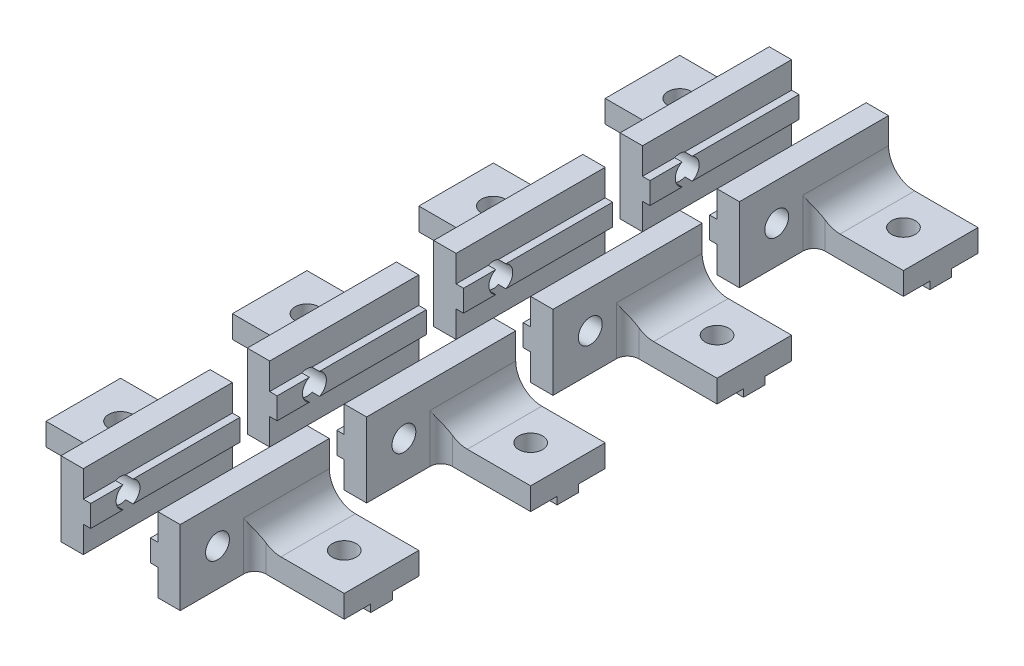
from build123d import *

# Parameters (mm, degrees)
MAIN_DEPTH                   = 20
ESQUISSE4_W                  = 20
ESQUISSE4_H                  = 2.9
VERTICALGUIDANCE_DEPTH       = 1
VERTICALHOLE_DEPTH           = 27.925824036
VERTICALHOLE_DEPTH_BACK      = 27.925824036
ESQUISSE2_R                  = 1.6
ESQUISSE5_W                  = 15
ESQUISSE5_H                  = 2.9
HORIZONTALGUIDANCE_DEPTH     = 1
HORIZONTALHOLE_DEPTH         = 26.961510049
HORIZONTALHOLE_DEPTH_BACK    = 26.961510049
ESQUISSE3_R                  = 1.6
ENL_V_MAT_EXTRU_4_DEPTH      = 26.961510049
ENL_V_MAT_EXTRU_4_DEPTH_BACK = 26.961510049
ESQUISSE9_W                  = 12
ESQUISSE9_H                  = 10
CONG_2_R                     = 1.5
R_P_TITION_LIN_AIRE1_COUNT   = 4
R_P_TITION_LIN_AIRE1_PITCH   = 25


with BuildPart() as part:
    # Esquisse1 → Main (new body)
    with BuildSketch(Plane.XY):
        with BuildLine():
            Line((0, 0), (15, 0))
            Line((15, 0), (15, 3))
            Line((15, 3), (6.5, 3))
            ThreePointArc((6.5, 3), (4.025126266, 4.025126266), (3, 6.5))
            Line((3, 6.5), (3, 10))
            Line((3, 10), (0, 10))
            Line((0, 10), (0, 0))
        make_face()
    extrude(amount=MAIN_DEPTH)

    # Esquisse4 → VerticalGuidance (add)
    with BuildSketch(Plane.ZY):
        with Locations((10, 5)):
            Rectangle(ESQUISSE4_W, ESQUISSE4_H)
    extrude(amount=VERTICALGUIDANCE_DEPTH)

    # Esquisse2 → VerticalHole (cut, two sides: drawn at the far end of the back side and taken through both)
    with BuildSketch(Plane.ZY.offset(-VERTICALHOLE_DEPTH_BACK)):
        with Locations((15, 5)):
            Circle(ESQUISSE2_R)
    extrude(amount=VERTICALHOLE_DEPTH + VERTICALHOLE_DEPTH_BACK, mode=Mode.SUBTRACT)

    # Esquisse5 → HorizontalGuidance (add)
    with BuildSketch(Plane(origin=(0, 0, 0), x_dir=(-1, 0, 0), z_dir=(0, -1, 0))):
        with Locations((-7.5, -5)):
            Rectangle(ESQUISSE5_W, ESQUISSE5_H)
    extrude(amount=HORIZONTALGUIDANCE_DEPTH)

    # Esquisse3 → HorizontalHole (cut, two sides: drawn at the far end of the back side and taken through both)
    with BuildSketch(Plane.XZ.offset(-3).offset(-HORIZONTALHOLE_DEPTH_BACK)):
        with Locations((10, 5)):
            Circle(ESQUISSE3_R)
    extrude(amount=HORIZONTALHOLE_DEPTH + HORIZONTALHOLE_DEPTH_BACK, mode=Mode.SUBTRACT)

    # Esquisse9 → Enlèv. mat.-Extru.4 (cut, two sides: drawn at the far end of the back side and taken through both)
    with BuildSketch(Plane(origin=(0, 3, 0), x_dir=(1, 0, 0), z_dir=(0, 1, 0)).offset(-ENL_V_MAT_EXTRU_4_DEPTH_BACK)):
        with Locations((9, -15)):
            Rectangle(ESQUISSE9_W, ESQUISSE9_H)
    extrude(amount=ENL_V_MAT_EXTRU_4_DEPTH + ENL_V_MAT_EXTRU_4_DEPTH_BACK, mode=Mode.SUBTRACT)

    # Congé2
    cong_2_edges = [part.edges().sort_by_distance(p)[0] for p in [
        (3, 3.25, 10),
    ]]
    fillet(cong_2_edges, radius=CONG_2_R)


with BuildPart() as r_p_tition_lin_aire1_1:
    # Répétition linéaire1: pattern copy
    add(part.part.moved(Location(Vector(0, 0, 1) * (1 * R_P_TITION_LIN_AIRE1_PITCH))))


with BuildPart() as r_p_tition_lin_aire1_2:
    # Répétition linéaire1: pattern copy
    add(part.part.moved(Location(Vector(0, 0, 1) * (2 * R_P_TITION_LIN_AIRE1_PITCH))))


with BuildPart() as r_p_tition_lin_aire1_3:
    # Répétition linéaire1: pattern copy
    add(part.part.moved(Location(Vector(0, 0, 1) * (3 * R_P_TITION_LIN_AIRE1_PITCH))))


with BuildPart() as body_5:
    # Symétrie3: mirrored copy
    add(r_p_tition_lin_aire1_1.part.mirror(Plane(origin=(-5, 0, 0), x_dir=(0, 0, 1), z_dir=(1, 0, 0))))


with BuildPart() as body_6:
    # Sym_trie3 2: mirrored copy
    add(part.part.mirror(Plane(origin=(-5, 0, 0), x_dir=(0, 0, 1), z_dir=(1, 0, 0))))


with BuildPart() as body_7:
    # Sym_trie3 3: mirrored copy
    add(r_p_tition_lin_aire1_2.part.mirror(Plane(origin=(-5, 0, 0), x_dir=(0, 0, 1), z_dir=(1, 0, 0))))


with BuildPart() as body_8:
    # Sym_trie3 4: mirrored copy
    add(r_p_tition_lin_aire1_3.part.mirror(Plane(origin=(-5, 0, 0), x_dir=(0, 0, 1), z_dir=(1, 0, 0))))


solid = Compound([part.part, r_p_tition_lin_aire1_1.part, r_p_tition_lin_aire1_2.part, r_p_tition_lin_aire1_3.part, body_5.part, body_6.part, body_7.part, body_8.part])
